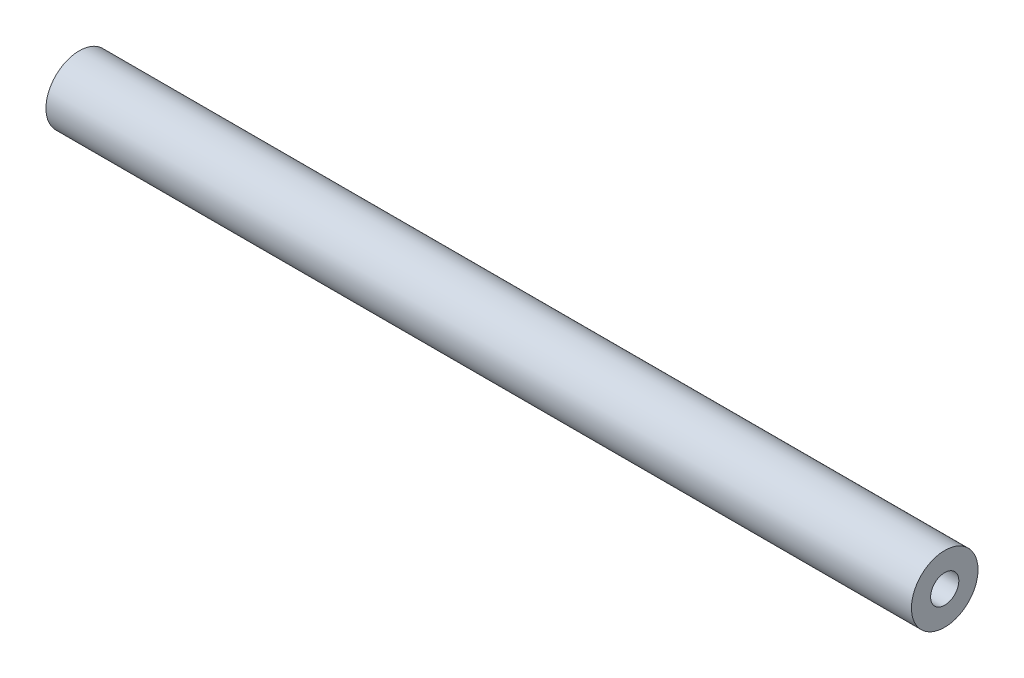
from build123d import *

# Parameters (mm, degrees)
SKETCH1_R                            = 4.7625
BOSS_EXTRUDE1_DEPTH                  = 61.9125
F_10_32_TAPPED_HOLE1_D               = 4.0386
F_10_32_TAPPED_HOLE1_DEPTH           = 16.256
F_10_32_TAPPED_HOLE1_TIP             = 1.213317848
F_10_32_TAPPED_HOLE1_ON_FACE_2_D     = 4.0386
F_10_32_TAPPED_HOLE1_ON_FACE_2_DEPTH = 16.256
F_10_32_TAPPED_HOLE1_ON_FACE_2_TIP   = 1.213317848


with BuildPart() as part:
    # Sketch1 → Boss-Extrude1 (new, symmetric)
    with BuildSketch(Plane(origin=(0, 0, 0), x_dir=(0, 0, -1), z_dir=(1, 0, 0))):
        Circle(SKETCH1_R)
    extrude(amount=BOSS_EXTRUDE1_DEPTH, both=True)

    # #10-32 Tapped Hole1
    with Locations(Plane(origin=(61.9125, 0, 0), x_dir=(0, 0, 1), z_dir=(1, 0, 0))):
        with Locations((0, 0)):
            Hole(F_10_32_TAPPED_HOLE1_D / 2, depth=F_10_32_TAPPED_HOLE1_DEPTH)
            with Locations((0, 0, -(F_10_32_TAPPED_HOLE1_DEPTH + F_10_32_TAPPED_HOLE1_TIP / 2))):  # 118° drill point
                Cone(0, F_10_32_TAPPED_HOLE1_D / 2, F_10_32_TAPPED_HOLE1_TIP, mode=Mode.SUBTRACT)

    # #10-32 Tapped Hole1 on face 2
    with Locations(Plane(origin=(-61.9125, 0, 0), x_dir=(0, 0, -1), z_dir=(-1, 0, 0))):
        with Locations((0, 0)):
            Hole(F_10_32_TAPPED_HOLE1_ON_FACE_2_D / 2, depth=F_10_32_TAPPED_HOLE1_ON_FACE_2_DEPTH)
            with Locations((0, 0, -(F_10_32_TAPPED_HOLE1_ON_FACE_2_DEPTH + F_10_32_TAPPED_HOLE1_ON_FACE_2_TIP / 2))):  # 118° drill point
                Cone(0, F_10_32_TAPPED_HOLE1_ON_FACE_2_D / 2, F_10_32_TAPPED_HOLE1_ON_FACE_2_TIP, mode=Mode.SUBTRACT)


solid = part.part
